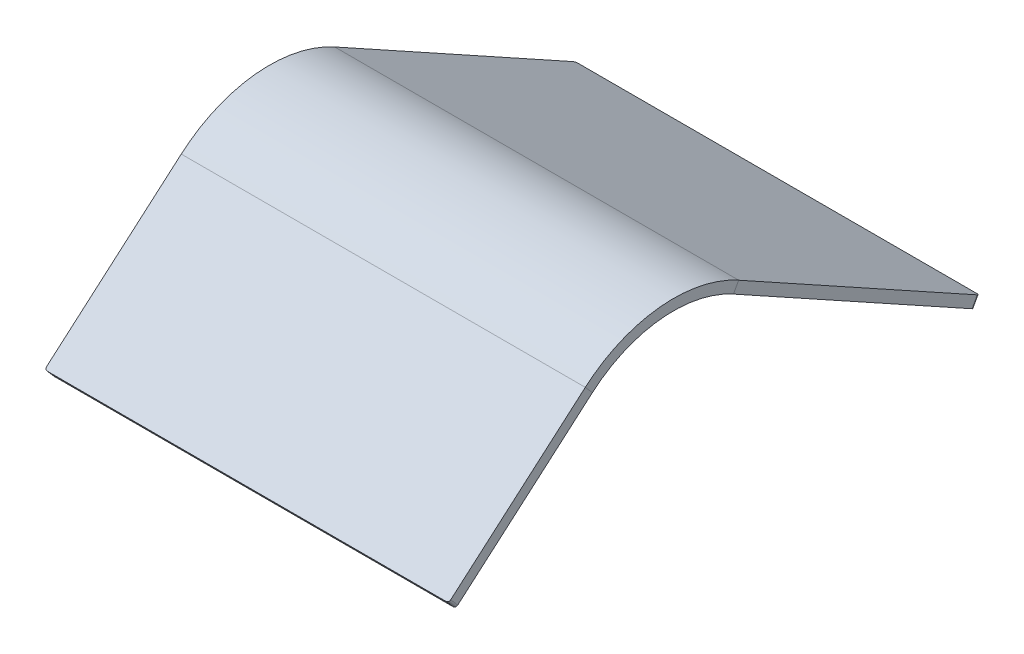
from build123d import *

# Parameters (mm, degrees)
BASE_FLANGE1_DEPTH = 150
FILLET_2_0_R       = 2


# Sheet-metal steps are written as plain solids
with BuildPart() as part:
    # Sketch1 → Base-Flange1 (new, symmetric)
    with BuildSketch(Plane(origin=(0, 0, 0), x_dir=(0, 0, -1), z_dir=(1, 0, 0))):
        with BuildLine():
            Line((-385, 0), (-283.559185115, 87.915372901))
            ThreePointArc((-283.559185115, 87.915372901), (-232.892960746, 109.891059496), (-178.771928145, 98.895109186))
            Line((-178.771928145, 98.895109186), (0, 0))
            Line((0, 0), (3.872491081, 7.000272339))
            Line((3.872491081, 7.000272339), (-174.899437063, 105.895381526))
            ThreePointArc((-174.899437063, 105.895381526), (-233.726646413, 117.847501428), (-288.798629422, 93.960885563))
            Line((-288.798629422, 93.960885563), (-390.239444307, 6.045512662))
            Line((-390.239444307, 6.045512662), (-385, 0))
        make_face()
    extrude(amount=BASE_FLANGE1_DEPTH, both=True)

    # Fillet-2.0
    fillet_2_0_edges = [part.edges().sort_by_distance(p)[0] for p in [
        (150, 3.022756331, 387.619722154),
        (150, 3.50013617, -1.936245541),
        (-150, 3.022756331, 387.619722154),
        (-150, 3.50013617, -1.936245541),
    ]]
    fillet(fillet_2_0_edges, radius=FILLET_2_0_R)


solid = part.part
